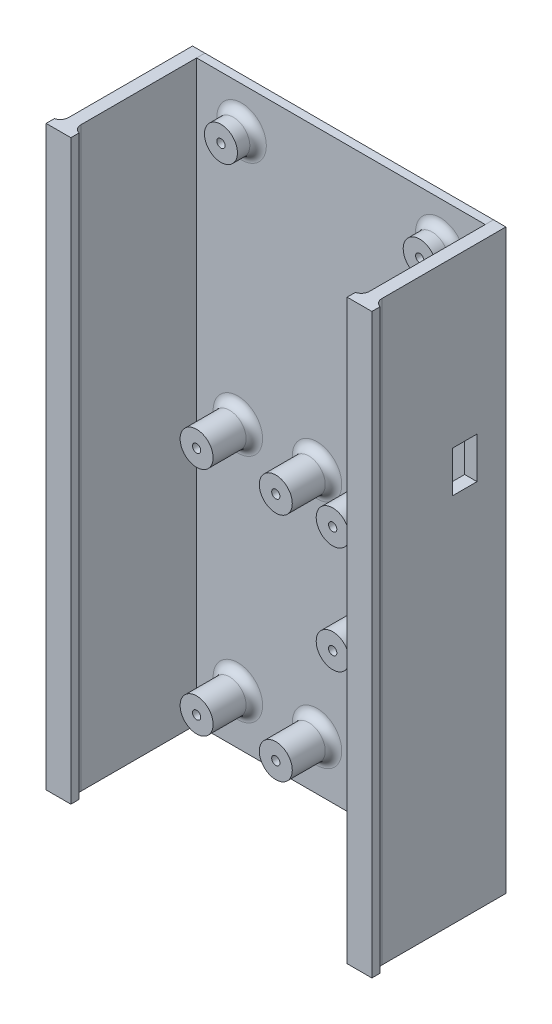
from build123d import *

# Parameters (mm, degrees)
SKICA1_W                  = 70
SKICA1_H                  = 140
P_IDAT_VYSUNUT_M1_DEPTH   = 2
SKICA2_R                  = 4
SKICA2_R_2                = 1
P_IDAT_VYSUNUT_M2_DEPTH   = 10
SKICA4_W                  = 3
SKICA4_H                  = 140
P_IDAT_VYSUNUT_M3_DEPTH   = 32
P_IDAT_VYSUNUT_M3_2_DEPTH = 32
SKICA5_W                  = 6
SKICA5_H                  = 10
ODEBRAT_VYSUNUT_M2_DEPTH  = 20
ODEBRAT_START             = -5
SKICA6_R                  = 4
ODEBRAT_VYSUNUT_M3_DEPTH  = 5
ZAOBLIT1_R                = 2
SKICA7_W                  = 6
SKICA7_H                  = 2
P_IDAT_VYSUNUT_M4_DEPTH   = 140
ZAOBLIT2_R                = 2
ZAOBLIT3_R                = 2


with BuildPart() as part:
    # Skica1 → Přidat vysunutím1 (new body)
    with BuildSketch(Plane.XY):
        with Locations((35, 70)):
            Rectangle(SKICA1_W, SKICA1_H)
    extrude(amount=P_IDAT_VYSUNUT_M1_DEPTH)

    # Skica2 → Přidat vysunutím2 (add)
    # profile 1 of 11: a face of its own
    with BuildSketch(Plane.XY.offset(2)):
        with Locations(Location((10, 68, 0), (0, 0, 180))):
            Circle(SKICA2_R)
        with Locations((10, 68)):
            Circle(SKICA2_R_2, mode=Mode.SUBTRACT)
    # profile 2 of 11: a face of its own
    with BuildSketch(Plane.XY.offset(2)):
        with Locations(Location((29.2, 67.999993937, 0), (0, 0, 180))):
            Circle(SKICA2_R)
        with Locations((29.2, 67.999993937)):
            Circle(SKICA2_R_2, mode=Mode.SUBTRACT)
    # profile 3 of 11: a face of its own
    with BuildSketch(Plane.XY.offset(2)):
        with Locations(Location((43, 68, 0), (0, 0, 180))):
            Circle(SKICA2_R)
        with Locations((43, 68)):
            Circle(SKICA2_R_2, mode=Mode.SUBTRACT)
    # profile 4 of 11: a face of its own
    with BuildSketch(Plane.XY.offset(2)):
        with Locations(Location((60, 68, 0), (0, 0, 180))):
            Circle(SKICA2_R)
        with Locations((60, 68)):
            Circle(SKICA2_R_2, mode=Mode.SUBTRACT)
    # profile 5 of 11: a face of its own
    with BuildSketch(Plane.XY.offset(2)):
        with Locations(Location((60, 42, 0), (0, 0, 180))):
            Circle(SKICA2_R)
        with Locations((60, 42)):
            Circle(SKICA2_R_2, mode=Mode.SUBTRACT)
    # profile 6 of 11: a face of its own
    with BuildSketch(Plane.XY.offset(2)):
        with Locations(Location((55, 30, 0), (0, 0, 180))):
            Circle(SKICA2_R)
        with Locations((55, 30)):
            Circle(SKICA2_R_2, mode=Mode.SUBTRACT)
    # profile 7 of 11: a face of its own
    with BuildSketch(Plane.XY.offset(2)):
        with Locations(Location((29.2, 11.999993937, 0), (0, 0, 180))):
            Circle(SKICA2_R)
        with Locations((29.2, 11.999993937)):
            Circle(SKICA2_R_2, mode=Mode.SUBTRACT)
    # profile 8 of 11: a face of its own
    with BuildSketch(Plane.XY.offset(2)):
        with Locations(Location((10, 12, 0), (0, 0, 180))):
            Circle(SKICA2_R)
        with Locations((10, 12)):
            Circle(SKICA2_R_2, mode=Mode.SUBTRACT)
    # profile 9 of 11: a face of its own
    with BuildSketch(Plane.XY.offset(2)):
        with Locations(Location((10.9, 130, 0), (0, 0, 180))):
            Circle(SKICA2_R)
        with Locations((10.9, 130)):
            Circle(SKICA2_R_2, mode=Mode.SUBTRACT)
    # profile 10 of 11: a face of its own
    with BuildSketch(Plane.XY.offset(2)):
        with Locations(Location((59.1, 129.999993937, 0), (0, 0, 180))):
            Circle(SKICA2_R)
        with Locations((59.1, 129.999993937)):
            Circle(SKICA2_R_2, mode=Mode.SUBTRACT)
    # profile 11 of 11: a face of its own
    with BuildSketch(Plane.XY.offset(2)):
        with Locations(Location((43, 42, 0), (0, 0, 180))):
            Circle(SKICA2_R)
        with Locations((43, 42)):
            Circle(SKICA2_R_2, mode=Mode.SUBTRACT)
    extrude(amount=P_IDAT_VYSUNUT_M2_DEPTH)

    # Skica6 → Odebrat vysunutím3 (cut)
    with BuildSketch(Plane.XY.offset(12).offset(ODEBRAT_START)):
        with Locations(Location((10.9, 130, 0), (0, 0, 180))):
            Circle(SKICA6_R)
        with Locations(Location((59.1, 129.999993937, 0), (0, 0, 180))):
            Circle(SKICA6_R)
    extrude(amount=ODEBRAT_VYSUNUT_M3_DEPTH, mode=Mode.SUBTRACT)

    # Zaoblit1
    zaoblit1_edges = [part.edges().sort_by_distance(p)[0] for p in [
        (14, 68, 2),
        (33.2, 67.999993937, 2),
        (47, 68, 2),
        (64, 68, 2),
        (64, 42, 2),
        (59, 30, 2),
        (33.2, 11.999993937, 2),
        (14, 12, 2),
        (14.9, 130, 2),
        (63.1, 129.999993937, 2),
        (47, 42, 2),
    ]]
    fillet(zaoblit1_edges, radius=ZAOBLIT1_R)


with BuildPart() as body_2:
    # Skica4 → Přidat vysunutím3 (new body)
    with BuildSketch(Plane.XY):
        with Locations((-1.5, 70)):
            Rectangle(SKICA4_W, SKICA4_H)
    extrude(amount=P_IDAT_VYSUNUT_M3_DEPTH)



with BuildPart() as body_3:
    # Skica4 → P_idat vysunut_m3 2 (new body)
    with BuildSketch(Plane.XY):
        with Locations((71.5, 70)):
            Rectangle(SKICA4_W, SKICA4_H)
    extrude(amount=P_IDAT_VYSUNUT_M3_2_DEPTH)

    # Skica5 → Odebrat vysunutím2 (cut)
    with BuildSketch(Plane(origin=(73, 0, 0), x_dir=(0, 0, -1), z_dir=(1, 0, 0))):
        with Locations((-10, 95)):
            Rectangle(SKICA5_W, SKICA5_H)
    extrude(amount=-ODEBRAT_VYSUNUT_M2_DEPTH, mode=Mode.SUBTRACT)


with BuildPart() as body_2_1:
    add(body_2.part)

    add(body_3.part)  # Přidat vysunutím4 merges body 3
    # Skica7 → Přidat vysunutím4 (add)
    with BuildSketch(Plane.XZ):
        with Locations((-1.5, 33)):
            Rectangle(SKICA7_W, SKICA7_H)
        with Locations((71.5, 33)):
            Rectangle(SKICA7_W, SKICA7_H)
    extrude(amount=-P_IDAT_VYSUNUT_M4_DEPTH)

    # Zaoblit2
    # the kernel refuses this fillet: 2 mm, written as the material it adds along each edge
    with BuildSketch(Plane(origin=(-3, 0, 32), x_dir=(-1, 0, 0), z_dir=(0, 1, 0)), Plane(origin=(0, 140, 32), x_dir=(1, 0, 0), z_dir=(0, -1, 0))) as zaoblit2_piece_1:
        with BuildLine():
            CenterArc((2, -1.936491673), ZAOBLIT2_R, 104.477512186, 75.522487814)
            Line((0, -1.936491673), (-0.04, -1.936491673))
            Line((-0.04, -1.936491673), (-0.04, 0))
            Line((-0.04, 0), (0, 0.04))
            ThreePointArc((0, 0.04), (0.75, 0.04), (1.49, 0.038729833))
            Line((1.49, 0.038729833), (1.5, 0))
        make_face()
    extrude(amount=140)

    # Zaoblit3
    # the kernel refuses this fillet: 2 mm, written as the material it adds along each edge
    with BuildSketch(Plane(origin=(73, 0, 32), x_dir=(1, 0, 0), z_dir=(0, 1, 0)), Plane(origin=(70, 140, 32), x_dir=(-1, 0, 0), z_dir=(0, -1, 0))) as zaoblit3_piece_1:
        with BuildLine():
            CenterArc((2, 1.936491673), ZAOBLIT3_R, 180, 75.522487814)
            Line((0, 1.936491673), (-0.04, 1.936491673))
            Line((-0.04, 1.936491673), (-0.04, 0))
            Line((-0.04, 0), (0, -0.04))
            ThreePointArc((0, -0.04), (0.75, -0.04), (1.49, -0.038729833))
            Line((1.49, -0.038729833), (1.5, 0))
        make_face()
    extrude(amount=140)


solid = Compound([part.part, body_2_1.part])
